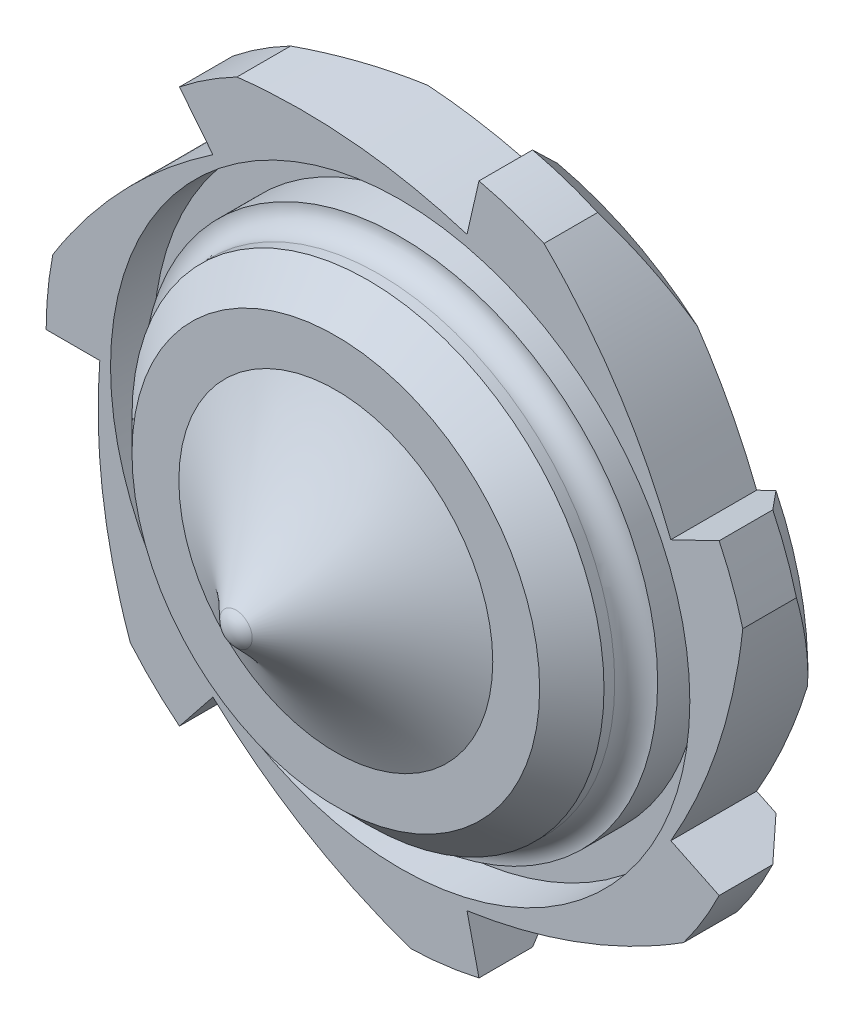
from build123d import *

# Parameters (mm, degrees)
ESQUISSE1_R                     = 33
BOSS_EXTRU_1_DEPTH              = 3
ESQUISSE2_R                     = 33
BOSS_EXTRU_2_DEPTH              = 5
CONG_1_R                        = 2
ESQUISSE3_R                     = 22
BOSS_EXTRU_3_DEPTH              = 6
CHANFREIN1_SIZE                 = 3
CONG_2_R                        = 2
CHANFREIN2_SIZE                 = 3
ESQUISSE5_R                     = 27.000000000000004
ESQUISSE5_R_2                   = 24.000000000000004
ENL_V_DE_MAT_EXTRU_MINCE1_DEPTH = 4
ENL_V_MAT_EXTRU_1_DEPTH         = 53.44951392438422
ENL_V_MAT_EXTRU_1_DEPTH_BACK    = 53.44951392438422
ESQUISSE7_R                     = 23.930546597488352
ESQUISSE7_R_2                   = 21.930546597488352
ESQUISSE7_R_3                   = 8.12388129582667
ESQUISSE7_R_4                   = 6.123881295826671
ENL_V_DE_MAT_EXTRU_MINCE2_DEPTH = 2
CHANFREIN3_SIZE                 = 2
CHANFREIN4_SIZE2                = 2
CHANFREIN4_SIZE                 = 5.494954839
CHANFREIN5_SIZE                 = 4
CHANFREIN5_SIZE2                = 6.928203230275547
CHANFREIN6_SIZE                 = 4
CHANFREIN6_SIZE2                = 6.928203230275547


with BuildPart() as part:
    # Esquisse1 → Boss.-Extru.1 (new body)
    with BuildSketch(Plane.XY):
        Circle(ESQUISSE1_R)
        with BuildLine():
            Line((-10.675959520705847, -4.138404077932739), (-14.568869579057516, -5.436040764049933))
            ThreePointArc((-14.568869579057516, -5.436040764049933), (-15.362379148266376, 2.4082788262388735), (-12.206501566003407, 9.633473907119715))
            Line((-12.206501566003407, 9.633473907119715), (-8.89742874273069, 7.206820503386352))
            ThreePointArc((-8.89742874273069, 7.206820503386352), (-11.311848311745987, 1.773298556941165), (-10.675959520705847, -4.138404077932739))
        make_face(mode=Mode.SUBTRACT)
        with BuildLine():
            Line((14.568869579057514, 5.436040764049934), (10.675959520705844, 4.138404077932738))
            ThreePointArc((10.675959520705844, 4.138404077932738), (11.311848311745983, -1.7732985569411592), (8.897428742730693, -7.206820503386345))
            Line((8.897428742730693, -7.206820503386345), (12.206501566003409, -9.633473907119711))
            ThreePointArc((12.206501566003409, -9.633473907119711), (15.362379148266374, -2.4082788262388677), (14.568869579057514, 5.436040764049934))
        make_face(mode=Mode.SUBTRACT)
    extrude(amount=BOSS_EXTRU_1_DEPTH)

    # Esquisse2 → Boss.-Extru.2 (add)
    with BuildSketch(Plane.XY.offset(3)):
        Circle(ESQUISSE2_R)
        with BuildLine():
            Line((-12.102216214336107, -9.764162160751955), (-8.819426211517364, -7.302069658637931))
            ThreePointArc((-8.819426211517364, -7.302069658637931), (-11.449834531594213, -0.061556470926751), (-8.897428742730693, 7.206820503386354))
            Line((-8.897428742730693, 7.206820503386354), (-12.206501566003409, 9.633473907119713))
            ThreePointArc((-12.206501566003409, 9.633473907119713), (-15.549775280898679, -0.08359852601843287), (-12.102216214336107, -9.764162160751955))
        make_face(mode=Mode.SUBTRACT)
        with BuildLine():
            Line((12.102216214336359, 9.76416216075164), (8.819426211517387, 7.302069658637905))
            ThreePointArc((8.819426211517387, 7.302069658637905), (11.449834531594213, 0.06155647092658078), (8.897428742730495, -7.206820503386595))
            Line((8.897428742730495, -7.206820503386595), (12.206501566003364, -9.63347390711977))
            ThreePointArc((12.206501566003364, -9.63347390711977), (15.54977528089868, 0.0835985260181948), (12.102216214336359, 9.76416216075164))
        make_face(mode=Mode.SUBTRACT)
    extrude(amount=BOSS_EXTRU_2_DEPTH)

    # Congé1
    cong_1_edges = [part.edges().sort_by_distance(p)[0] for p in [
        (-12.622414549881682, -4.787222420991336, 3),
        (12.622414549881679, 4.787222420991336, 3),
    ]]
    fillet(cong_1_edges, radius=CONG_1_R)

    # Esquisse3 → Boss.-Extru.3 (add)
    with BuildSketch(Plane.XY.offset(8)):
        Circle(ESQUISSE3_R)
    extrude(amount=BOSS_EXTRU_3_DEPTH)

    # Esquisse4 → Révolution3 (revolve)
    with BuildSketch(Plane(origin=(0, 0, 0), x_dir=(1, 0, 0), z_dir=(0, 1, 0))):
        with BuildLine():
            Line((0, -13.999999999999998), (0, -23.936405555224336))
            ThreePointArc((0, -23.936405555224336), (-0.8193291269458294, -23.773207312008758), (-1.5135934632740111, -23.308523638793037))
            ThreePointArc((-1.5135934632740111, -23.308523638793037), (-7.677772539936917, -18.09763553075605), (-14.631896612797249, -14))
            Line((-14.631896612797249, -14), (0, -13.999999999999998))
        make_face()
    revolve(axis=Axis((0, 0, 13.999999999999998), (0, 0, 1)))

    # Chanfrein1
    chanfrein1_edges = [part.edges().sort_by_distance(p)[0] for p in [
        (-33, 4.04e-15, 0),
    ]]
    chamfer(chanfrein1_edges, length=CHANFREIN1_SIZE)

    # Congé2
    cong_2_edges = [part.edges().sort_by_distance(p)[0] for p in [
        (-22, 1.246e-14, 8),
    ]]
    fillet(cong_2_edges, radius=CONG_2_R)

    # Chanfrein2
    chanfrein2_edges = [part.edges().sort_by_distance(p)[0] for p in [
        (-22, 1.246e-14, 14),
    ]]
    chamfer(chanfrein2_edges, length=CHANFREIN2_SIZE)

    # Esquisse5 → Enlèv. de mat.-Extru.-Mince1 (cut)
    with BuildSketch(Plane.XY.offset(8)):
        Circle(ESQUISSE5_R)
        Circle(ESQUISSE5_R_2, mode=Mode.SUBTRACT)
    extrude(amount=-ENL_V_DE_MAT_EXTRU_MINCE1_DEPTH, mode=Mode.SUBTRACT)

    # Esquisse6 → Enlèv. mat.-Extru.1 (cut, two sides: drawn at the far end of the back side and taken through both)
    with BuildSketch(Plane(origin=(0, 0, 0), x_dir=(-1, 0, 0), z_dir=(0, 0, -1)).offset(-ENL_V_MAT_EXTRU_1_DEPTH_BACK)):
        with BuildLine():
            Line((17.457714452044502, -21.891281509104868), (21.744690267234997, -27.266979149873006))
            Line((21.744690267234997, -27.266979149873006), (10.757517205682898, -34.42702004009948))
            Line((10.757517205682898, -34.42702004009948), (-4.348149134028366, -34.02756682996412))
            add(Edge.make_bspline(
                [(17.457714452044502, -21.891281509104868), (8.150142920234186, -30.55152022572505), (-4.348149134028366, -34.02756682996412)],
                knots=[0, 0, 0, 1, 1, 1], degree=2))
        make_face()
        with BuildLine():
            Line((28, 0), (34.87577535736795, 0))
            Line((34.87577535736795, 0), (33.62333038597071, -13.05433027879381))
            Line((33.62333038597071, -13.05433027879381), (23.89279637742328, -24.61536078399858))
            add(Edge.make_bspline(
                [(28, 0), (28.967671344187806, -12.676522970367387), (23.89279637742328, -24.61536078399858)],
                knots=[0, 0, 0, 1, 1, 1], degree=2))
        make_face()
        with BuildLine():
            Line((-6.230586150776911, -27.29798154109103), (-7.760590104972264, -34.00136685488099))
            Line((-7.760590104972264, -34.00136685488099), (-20.208925843844458, -29.875461527982615))
            Line((-20.208925843844458, -29.875461527982615), (-29.314849661478412, -17.816321017099597))
            add(Edge.make_bspline(
                [(-6.230586150776911, -27.29798154109103), (-18.80460935527342, -25.420599613673357), (-29.314849661478412, -17.816321017099597)],
                knots=[0, 0, 0, 1, 1, 1], degree=2))
        make_face()
        with BuildLine():
            Line((-25.22712830126781, -12.148744695291473), (-31.421987840946983, -15.132031816678607))
            Line((-31.421987840946983, -15.132031816678607), (-35.95763554599567, -2.827071136940631))
            Line((-35.95763554599567, -2.827071136940631), (-32.20687047987901, 11.810977908358138))
            add(Edge.make_bspline(
                [(-25.22712830126781, -12.148744695291473), (-31.59910724213477, -1.1474490067937917), (-32.20687047987901, 11.810977908358138)],
                knots=[0, 0, 0, 1, 1, 1], degree=2))
        make_face()
        with BuildLine():
            Line((-25.22712830126764, 12.148744695291825), (-31.42198784094677, 15.132031816679044))
            Line((-31.42198784094677, 15.132031816679044), (-24.629512279918224, 26.350161481959308))
            Line((-24.629512279918224, 26.350161481959308), (-10.846460926500809, 32.54436956877975))
            add(Edge.make_bspline(
                [(-25.22712830126764, 12.148744695291825), (-20.598832871349522, 23.98975410589561), (-10.846460926500809, 32.54436956877975)],
                knots=[0, 0, 0, 1, 1, 1], degree=2))
        make_face()
        with BuildLine():
            Line((-6.230586150776541, 27.297981541091115), (-7.760590104971805, 34.00136685488109))
            Line((-7.760590104971805, 34.00136685488109), (5.245136083428826, 35.68518505960543))
            Line((5.245136083428826, 35.68518505960543), (18.68155493201407, 28.77118715975353))
            add(Edge.make_bspline(
                [(-6.230586150776541, 27.297981541091115), (5.9127827911769995, 31.062183075042935), (18.68155493201407, 28.77118715975353)],
                knots=[0, 0, 0, 1, 1, 1], degree=2))
        make_face()
        with BuildLine():
            Line((17.457714452044808, 21.891281509104626), (21.74469026723538, 27.266979149872704))
            Line((21.74469026723538, 27.266979149872704), (31.17008999467649, 18.148536442251835))
            Line((31.17008999467649, 18.148536442251835), (34.14197889244976, 3.3327139941706876))
            add(Edge.make_bspline(
                [(17.457714452044808, 21.891281509104626), (27.971952413158835, 14.744154635620854), (34.14197889244976, 3.3327139941706876)],
                knots=[0, 0, 0, 1, 1, 1], degree=2))
        make_face()
    extrude(amount=ENL_V_MAT_EXTRU_1_DEPTH + ENL_V_MAT_EXTRU_1_DEPTH_BACK, mode=Mode.SUBTRACT)

    # Esquisse7 → Enlèv. de mat.-Extru.-Mince2 (cut)
    # profile 1 of 2: a face of its own
    with BuildSketch(Plane(origin=(0, 0, 0), x_dir=(-1, 0, 0), z_dir=(0, 0, -1))):
        Circle(ESQUISSE7_R)
        Circle(ESQUISSE7_R_2, mode=Mode.SUBTRACT)
    # profile 2 of 2: a face of its own
    with BuildSketch(Plane(origin=(0, 0, 0), x_dir=(-1, 0, 0), z_dir=(0, 0, -1))):
        Circle(ESQUISSE7_R_3)
        Circle(ESQUISSE7_R_4, mode=Mode.SUBTRACT)
    extrude(amount=-ENL_V_DE_MAT_EXTRU_MINCE2_DEPTH, mode=Mode.SUBTRACT)

    # Chanfrein3
    chanfrein3_edges = [part.edges().sort_by_distance(p)[0] for p in [
        (6.123881295826671, 7.5e-16, 0),
    ]]
    chamfer(chanfrein3_edges, length=CHANFREIN3_SIZE - 0.0001)  # a hair under: the kernel refuses the full size

    # Chanfrein4
    chanfrein4_edges = [part.edges().sort_by_distance(p)[0] for p in [
        (21.930546597488352, 2.69e-15, 0),
    ]]
    chanfrein4_side = [part.faces().sort_by_distance(p)[0] for p in [
        (21.890546597488353, 2.68e-15, 0),
    ]]
    chamfer(chanfrein4_edges, length=CHANFREIN4_SIZE - 0.0001, length2=CHANFREIN4_SIZE2 - 0.0001, reference=chanfrein4_side[0])  # a hair under: the kernel refuses the full size

    # Chanfrein5
    chanfrein5_edges = [part.edges().sort_by_distance(p)[0] for p in [
        (10.551965154367052, -8.420147205253029, 0),
    ]]
    chanfrein5_side = [part.faces().sort_by_distance(p)[0] for p in [
        (15.970820194651594, 1.96e-15, 0),
    ]]
    chamfer(chanfrein5_edges, length=CHANFREIN5_SIZE, length2=CHANFREIN5_SIZE2, reference=chanfrein5_side[0])

    # Chanfrein6
    chanfrein6_edges = [part.edges().sort_by_distance(p)[0] for p in [
        (-10.55196515436705, 8.420147205253034, 0),
    ]]
    chanfrein6_side = [part.faces().sort_by_distance(p)[0] for p in [
        (10.37156741301878, -3.6198944951765126, 0),
    ]]
    chamfer(chanfrein6_edges, length=CHANFREIN6_SIZE, length2=CHANFREIN6_SIZE2, reference=chanfrein6_side[0])


solid = part.part
